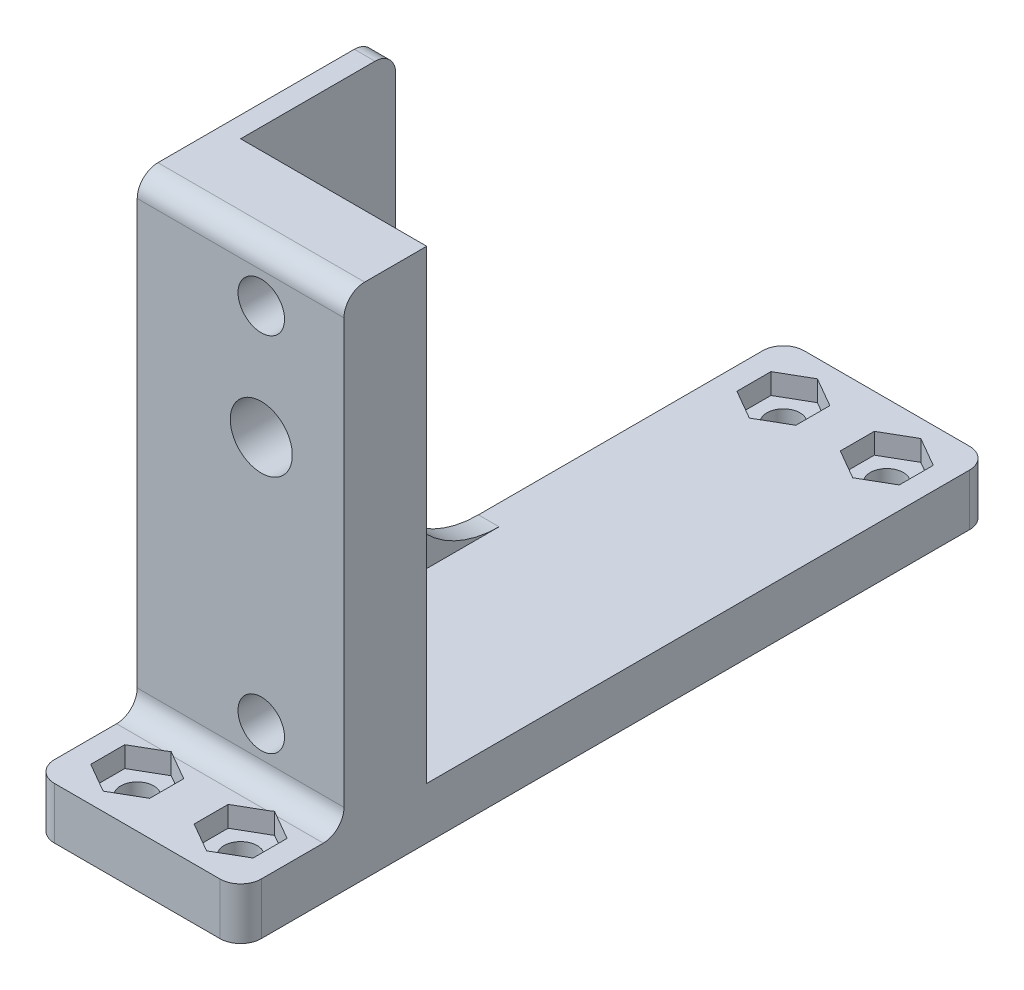
from build123d import *

# Parameters (mm, degrees)
CROQUIS1_W              = 20
CROQUIS1_H              = 72.5
CROQUIS1_R              = 1.6
SALIENTE_EXTRUIR1_DEPTH = 5
CORTAR_EXTRUIR1_DEPTH   = 2
CROQUIS3_W              = 20
CROQUIS3_H              = 8
SALIENTE_EXTRUIR2_DEPTH = 45
CROQUIS4_R              = 2.25
CROQUIS4_R_2            = 3
CORTAR_EXTRUIR2_DEPTH   = 45
CROQUIS5_W              = 15
CROQUIS5_H              = 45
CROQUIS5_R              = 1.6
SALIENTE_EXTRUIR3_DEPTH = 2
REDONDEO2_R             = 2
REDONDEO3_R             = 10


with BuildPart() as part:
    # Croquis1 → Saliente-Extruir1 (new body)
    with BuildSketch(Plane(origin=(0, 0, 0), x_dir=(1, 0, 0), z_dir=(0, 1, 0))):
        Rectangle(CROQUIS1_W, CROQUIS1_H)
        with Locations(Location((-5, 31.25, 0), (0, 0, 270))):
            Circle(CROQUIS1_R, mode=Mode.SUBTRACT)
        with Locations(Location((5, 31.25, 0), (0, 0, 270))):
            Circle(CROQUIS1_R, mode=Mode.SUBTRACT)
        with Locations(Location((-5, -31.25, 0), (0, 0, 270))):
            Circle(CROQUIS1_R, mode=Mode.SUBTRACT)
        with Locations(Location((5, -31.25, 0), (0, 0, 270))):
            Circle(CROQUIS1_R, mode=Mode.SUBTRACT)
    extrude(amount=SALIENTE_EXTRUIR1_DEPTH)

    # Croquis2 → Cortar-Extruir1 (cut)
    with BuildSketch(Plane(origin=(0, 5, 0), x_dir=(1, 0, 0), z_dir=(0, 1, 0))):
        Polygon((-2.15, 29.604551733), (-2.15, 32.895448267), (-5, 34.540896534), (-7.85, 32.895448267), (-7.85, 29.604551733), (-5, 27.959103466), align=None)
        Polygon((5, 27.959103466), (7.85, 29.604551733), (7.85, 32.895448267), (5, 34.540896534), (2.15, 32.895448267), (2.15, 29.604551733), align=None)
        Polygon((-5, -34.540896534), (-2.15, -32.895448267), (-2.15, -29.604551733), (-5, -27.959103466), (-7.85, -29.604551733), (-7.85, -32.895448267), align=None)
        Polygon((5, -27.959103466), (2.15, -29.604551733), (2.15, -32.895448267), (5, -34.540896534), (7.85, -32.895448267), (7.85, -29.604551733), align=None)
    extrude(amount=-CORTAR_EXTRUIR1_DEPTH, mode=Mode.SUBTRACT)

    # Croquis3 → Saliente-Extruir2 (add)
    with BuildSketch(Plane(origin=(0, 5, 0), x_dir=(1, 0, 0), z_dir=(0, 1, 0))):
        with Locations((0, -22.25)):
            Rectangle(CROQUIS3_W, CROQUIS3_H)
    extrude(amount=SALIENTE_EXTRUIR2_DEPTH)

    # Croquis4 → Cortar-Extruir2 (cut)
    with BuildSketch(Plane(origin=(0, 0, 18.25), x_dir=(-1, 0, 0), z_dir=(0, 0, -1))):
        with Locations((-2, 10)):
            Circle(CROQUIS4_R)
        with Locations((-2, 45)):
            Circle(CROQUIS4_R)
        with Locations((-2, 34)):
            Circle(CROQUIS4_R_2)
    extrude(amount=-CORTAR_EXTRUIR2_DEPTH, mode=Mode.SUBTRACT)

    # Croquis5 → Saliente-Extruir3 (add)
    with BuildSketch(Plane.ZY.offset(10)):
        with Locations((10.75, 27.5)):
            Rectangle(CROQUIS5_W, CROQUIS5_H)
        with Locations((13.15, 42)):
            Circle(CROQUIS5_R, mode=Mode.SUBTRACT)
        with Locations((13.15, 10)):
            Circle(CROQUIS5_R, mode=Mode.SUBTRACT)
    extrude(amount=-SALIENTE_EXTRUIR3_DEPTH)

    # Redondeo2
    # the kernel refuses this fillet: 2 mm, written as the material it adds along each edge
    with BuildSketch(Plane(origin=(-10, 5, 26.25), x_dir=(0, 1, 0), z_dir=(1, 0, 0))) as redondeo2_piece_1_section:
        with BuildLine():
            CenterArc((REDONDEO2_R, REDONDEO2_R), REDONDEO2_R, 180, 90)
            Line((0, REDONDEO2_R), (0, 0))
            Line((0, 0), (REDONDEO2_R, 0))
        make_face()
    redondeo2_piece_1 = extrude(amount=20, mode=Mode.PRIVATE)
    redondeo2_piece_1 = split(redondeo2_piece_1, bisect_by=Plane(origin=(-7.126844401, 5.386325592, 29.187037653), z_dir=(-0.4999999999999993, 0, -0.866025403784439)), keep=Keep.TOP, mode=Mode.PRIVATE)
    redondeo2_piece_1 = split(redondeo2_piece_1, bisect_by=Plane(origin=(-8.118654127, 5.386325592, 26.158547666), z_dir=(-0.49999999999999917, 0, 0.8660254037844392)), keep=Keep.TOP, mode=Mode.PRIVATE)
    add(redondeo2_piece_1)
    with BuildSketch(Plane(origin=(-10, 5, 26.25), x_dir=(0, 1, 0), z_dir=(1, 0, 0))) as redondeo2_piece_2_section:
        with BuildLine():
            CenterArc((REDONDEO2_R, REDONDEO2_R), REDONDEO2_R, 180, 90)
            Line((0, REDONDEO2_R), (0, 0))
            Line((0, 0), (REDONDEO2_R, 0))
        make_face()
    redondeo2_piece_2 = extrude(amount=20, mode=Mode.PRIVATE)
    redondeo2_piece_2 = split(redondeo2_piece_2, bisect_by=Plane(origin=(-4.392913505, 5.539408931, 27.608601914), z_dir=(-0.4999999999999993, 0, -0.866025403784439)), keep=Keep.TOP, mode=Mode.PRIVATE)
    redondeo2_piece_2 = split(redondeo2_piece_2, bisect_by=Plane(origin=(-5.607086495, 5.539408931, 27.608601914), z_dir=(0.49999999999999917, 0, -0.8660254037844392)), keep=Keep.TOP, mode=Mode.PRIVATE)
    add(redondeo2_piece_2)
    with BuildSketch(Plane(origin=(-10, 5, 26.25), x_dir=(0, 1, 0), z_dir=(1, 0, 0))) as redondeo2_piece_3_section:
        with BuildLine():
            CenterArc((REDONDEO2_R, REDONDEO2_R), REDONDEO2_R, 180, 90)
            Line((0, REDONDEO2_R), (0, 0))
            Line((0, 0), (REDONDEO2_R, 0))
        make_face()
    redondeo2_piece_3 = extrude(amount=20, mode=Mode.PRIVATE)
    redondeo2_piece_3 = split(redondeo2_piece_3, bisect_by=Plane(origin=(0.754095137, 5.386325592, 25.50772915), z_dir=(-0.4999999999999997, 0, 0.8660254037844388)), keep=Keep.TOP, mode=Mode.PRIVATE)
    redondeo2_piece_3 = split(redondeo2_piece_3, bisect_by=Plane(origin=(1.745904863, 5.386325592, 29.837856169), z_dir=(-0.5000000000000001, 0, -0.8660254037844386)), keep=Keep.TOP, mode=Mode.PRIVATE)
    redondeo2_piece_3 = split(redondeo2_piece_3, bisect_by=Plane(origin=(-0.754095137, 5.386325592, 25.50772915), z_dir=(0.4999999999999993, 0, 0.866025403784439)), keep=Keep.TOP, mode=Mode.PRIVATE)
    redondeo2_piece_3 = split(redondeo2_piece_3, bisect_by=Plane(origin=(-1.745904863, 5.386325592, 29.837856169), z_dir=(0.49999999999999917, 0, -0.8660254037844392)), keep=Keep.TOP, mode=Mode.PRIVATE)
    add(redondeo2_piece_3)
    with BuildSketch(Plane(origin=(-10, 5, 26.25), x_dir=(0, 1, 0), z_dir=(1, 0, 0))) as redondeo2_piece_4_section:
        with BuildLine():
            CenterArc((REDONDEO2_R, REDONDEO2_R), REDONDEO2_R, 180, 90)
            Line((0, REDONDEO2_R), (0, 0))
            Line((0, 0), (REDONDEO2_R, 0))
        make_face()
    redondeo2_piece_4 = extrude(amount=20, mode=Mode.PRIVATE)
    redondeo2_piece_4 = split(redondeo2_piece_4, bisect_by=Plane(origin=(4.392913505, 5.539408931, 27.608601914), z_dir=(0.4999999999999997, 0, -0.8660254037844388)), keep=Keep.TOP, mode=Mode.PRIVATE)
    redondeo2_piece_4 = split(redondeo2_piece_4, bisect_by=Plane(origin=(5.607086495, 5.539408931, 27.608601914), z_dir=(-0.5000000000000001, 0, -0.8660254037844386)), keep=Keep.TOP, mode=Mode.PRIVATE)
    add(redondeo2_piece_4)
    with BuildSketch(Plane(origin=(-10, 5, 26.25), x_dir=(0, 1, 0), z_dir=(1, 0, 0))) as redondeo2_piece_5_section:
        with BuildLine():
            CenterArc((REDONDEO2_R, REDONDEO2_R), REDONDEO2_R, 180, 90)
            Line((0, REDONDEO2_R), (0, 0))
            Line((0, 0), (REDONDEO2_R, 0))
        make_face()
    redondeo2_piece_5 = extrude(amount=20, mode=Mode.PRIVATE)
    redondeo2_piece_5 = split(redondeo2_piece_5, bisect_by=Plane(origin=(7.126844401, 5.386325592, 29.187037653), z_dir=(0.4999999999999997, 0, -0.8660254037844388)), keep=Keep.TOP, mode=Mode.PRIVATE)
    redondeo2_piece_5 = split(redondeo2_piece_5, bisect_by=Plane(origin=(8.118654127, 5.386325592, 26.158547666), z_dir=(0.5000000000000001, 0, 0.8660254037844386)), keep=Keep.TOP, mode=Mode.PRIVATE)
    add(redondeo2_piece_5)
    # the kernel refuses this fillet: 2 mm, written as the material it takes off along each edge
    with BuildSketch(Plane(origin=(-15, 50, 26.25), x_dir=(0, -1, 0), z_dir=(1, 0, 0))) as redondeo2_2_piece_1:
        with BuildLine():
            CenterArc((REDONDEO2_R, REDONDEO2_R), REDONDEO2_R, 180, 90)
            Line((0, REDONDEO2_R), (0, 0))
            Line((0, 0), (REDONDEO2_R, 0))
        make_face()
    extrude(amount=30, mode=Mode.SUBTRACT)
    with BuildSketch(Plane(origin=(-15, 50, 3.25), x_dir=(0, 0, 1), z_dir=(1, 0, 0))) as redondeo2_2_piece_2:
        with BuildLine():
            CenterArc((REDONDEO2_R, REDONDEO2_R), REDONDEO2_R, 180, 90)
            Line((0, REDONDEO2_R), (0, 0))
            Line((0, 0), (REDONDEO2_R, 0))
        make_face()
    extrude(amount=12, mode=Mode.SUBTRACT)
    with BuildSketch(Plane(origin=(-10, -5, -36.25), x_dir=(1, 0, 0), z_dir=(0, 1, 0)), Plane(origin=(10, -5, 36.25), x_dir=(-1, 0, 0), z_dir=(0, 1, 0))) as redondeo2_2_piece_3:
        with BuildLine():
            CenterArc((REDONDEO2_R, -REDONDEO2_R), REDONDEO2_R, 90, 90)
            Line((0, -REDONDEO2_R), (0, 0))
            Line((0, 0), (REDONDEO2_R, 0))
        make_face()
    extrude(amount=15, mode=Mode.SUBTRACT)
    with BuildSketch(Plane(origin=(10, -5, -36.25), x_dir=(-1, 0, 0), z_dir=(0, 1, 0)), Plane(origin=(-10, -5, 36.25), x_dir=(1, 0, 0), z_dir=(0, 1, 0))) as redondeo2_2_piece_4:
        with BuildLine():
            CenterArc((REDONDEO2_R, REDONDEO2_R), REDONDEO2_R, 180, 90)
            Line((0, REDONDEO2_R), (0, 0))
            Line((0, 0), (REDONDEO2_R, 0))
        make_face()
    extrude(amount=15, mode=Mode.SUBTRACT)

    # Redondeo3
    redondeo3_edges = [part.edges().sort_by_distance(p)[0] for p in [
        (-9, 5, 3.25),
    ]]
    fillet(redondeo3_edges, radius=REDONDEO3_R)


solid = part.part
